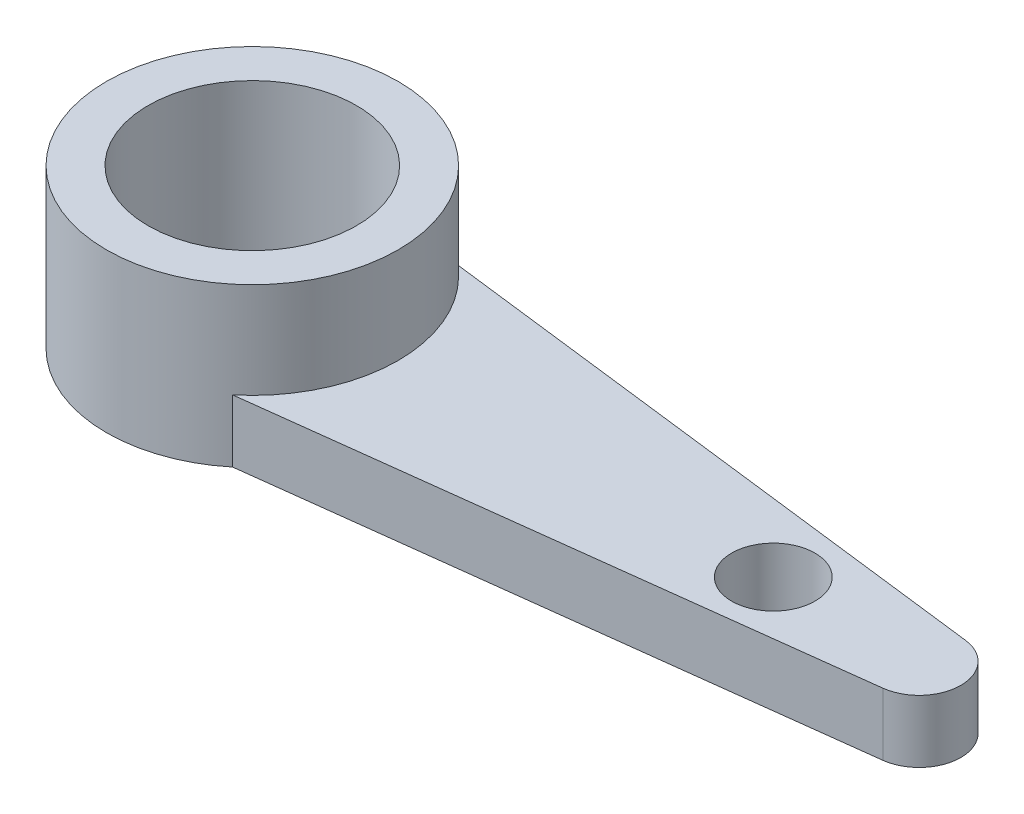
from build123d import *

# Parameters (mm, degrees)
SKETCH1_R           = 2.5
SKETCH1_R_2         = 1
BOSS_EXTRUDE1_DEPTH = 1.5
SKETCH1_3_R         = 2.5
BOSS_EXTRUDE2_DEPTH = 3.8


with BuildPart() as part:
    # Sketch1 → Boss-Extrude1 (new body)
    with BuildSketch(Plane(origin=(0, 0, 0), x_dir=(1, 0, 0), z_dir=(0, 1, 0))):
        with BuildLine():
            ThreePointArc((2.227105745, 2.7), (-3.5, 0), (2.227105745, -2.7))
            Line((2.227105745, -2.7), (16.121967257, -0.992534124))
            ThreePointArc((16.121967257, -0.992534124), (17, 0), (16.121967257, 0.992534124))
            Line((16.121967257, 0.992534124), (2.227105745, 2.7))
        make_face()
        Circle(SKETCH1_R, mode=Mode.SUBTRACT)
        with Locations((12.5, 0)):
            Circle(SKETCH1_R_2, mode=Mode.SUBTRACT)
    extrude(amount=BOSS_EXTRUDE1_DEPTH)

    # Sketch1<3> → Boss-Extrude2 (add)
    with BuildSketch(Plane(origin=(0, 0, 0), x_dir=(1, 0, 0), z_dir=(0, 1, 0))):
        with BuildLine():
            ThreePointArc((2.227105745, 2.7), (0, 3.5), (-2.227105745, 2.7))
            ThreePointArc((-2.227105745, 2.7), (-3.5, 0), (-2.227105745, -2.7))
            ThreePointArc((-2.227105745, -2.7), (0, -3.5), (2.227105745, -2.7))
            ThreePointArc((2.227105745, -2.7), (3.165822966, -1.492502913), (3.5, 0))
            ThreePointArc((3.5, 0), (3.165822966, 1.492502913), (2.227105745, 2.7))
        make_face()
        Circle(SKETCH1_3_R, mode=Mode.SUBTRACT)
    extrude(amount=BOSS_EXTRUDE2_DEPTH)


solid = part.part
